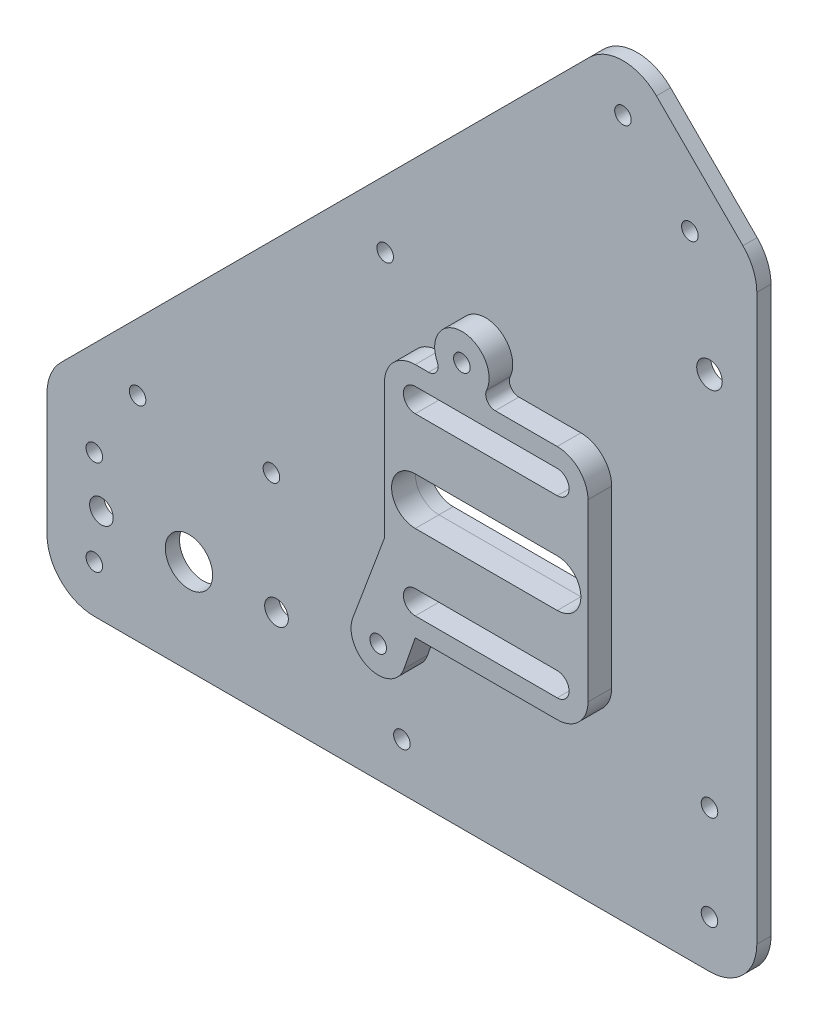
from build123d import *

# Parameters (mm, degrees)
FRAME_BRACKET_ALU_START       = 37.832624059
FRAME_BRACKET_ALU_OUTLINE_R   = 1.75
FRAME_BRACKET_ALU_OUTLINE_R_2 = 2.5
FRAME_BRACKET_ALU_OUTLINE_R_3 = 5
FRAME_BRACKET_ALU_OUTLINE_R_4 = 2.7
FRAME_BRACKET_ALU_DEPTH       = 3
SKETCH1_R                     = 1.75
BOSS_EXTRUDE1_DEPTH           = 5
FILLET1_R                     = 2


# Read off the part's stored shape, not the designer's step: frame_bracket_alu
with BuildPart() as part:
    # frame_bracket_alu outline → frame_bracket_alu (new body)
    with BuildSketch(Plane.XY.offset(FRAME_BRACKET_ALU_START)):
        with BuildLine():
            ThreePointArc((7.415225557, -30.959795658), (14.486293369, -28.03086347), (17.415225557, -20.959795658))
            Line((17.415225557, -20.959795658), (17.415225557, 98.329526223))
            ThreePointArc((17.415225557, 98.329526223), (16.654020882, 102.156360547), (14.486293369, 105.400594035))
            Line((14.486293369, 105.400594035), (-3.797977879, 123.684865282))
            ThreePointArc((-3.797977879, 123.684865282), (-10.86904569, 126.61379747), (-17.940113502, 123.684865282))
            Line((-17.940113502, 123.684865282), (-129.655842255, 11.96913653))
            ThreePointArc((-129.655842255, 11.96913653), (-131.823569768, 8.724903042), (-132.584774443, 4.898068718))
            Line((-132.584774443, 4.898068718), (-132.584774443, -20.959795658))
            ThreePointArc((-132.584774443, -20.959795658), (-129.655842255, -28.03086347), (-122.584774443, -30.959795658))
            Line((-122.584774443, -30.959795658), (7.415225557, -30.959795658))
        make_face()
        with Locations((-122.584774443, -20.959795658)):
            Circle(FRAME_BRACKET_ALU_OUTLINE_R, mode=Mode.SUBTRACT)
        with Locations((-121.084774443, -10.959795658)):
            Circle(FRAME_BRACKET_ALU_OUTLINE_R_2, mode=Mode.SUBTRACT)
        with Locations((-122.584774443, -0.959795658)):
            Circle(FRAME_BRACKET_ALU_OUTLINE_R, mode=Mode.SUBTRACT)
        with Locations((-102.584774443, -10.959795658)):
            Circle(FRAME_BRACKET_ALU_OUTLINE_R_3, mode=Mode.SUBTRACT)
        with Locations((-84.084774443, -10.959795658)):
            Circle(FRAME_BRACKET_ALU_OUTLINE_R_2, mode=Mode.SUBTRACT)
        with Locations((-113.442638819, 14.040204342)):
            Circle(FRAME_BRACKET_ALU_OUTLINE_R, mode=Mode.SUBTRACT)
        with Locations((-85.158367572, 14.040204342)):
            Circle(FRAME_BRACKET_ALU_OUTLINE_R, mode=Mode.SUBTRACT)
        with Locations((-57.584774443, -20.959795658)):
            Circle(FRAME_BRACKET_ALU_OUTLINE_R, mode=Mode.SUBTRACT)
        with Locations((-57.584774443, -0.959795658)):
            Circle(FRAME_BRACKET_ALU_OUTLINE_R, mode=Mode.SUBTRACT)
        with Locations((7.415225557, -20.959795658)):
            Circle(FRAME_BRACKET_ALU_OUTLINE_R, mode=Mode.SUBTRACT)
        with Locations((7.415225557, -0.959795658)):
            Circle(FRAME_BRACKET_ALU_OUTLINE_R, mode=Mode.SUBTRACT)
        with BuildLine():
            Line((-49.764538098, 13.040204342), (-19.764538098, 13.040204342))
            ThreePointArc((-19.764538098, 13.040204342), (-17.264538098, 10.540204342), (-19.764538098, 8.040204342))
            Line((-19.764538098, 8.040204342), (-49.764538098, 8.040204342))
            ThreePointArc((-49.764538098, 8.040204342), (-52.264538098, 10.540204342), (-49.764538098, 13.040204342))
        make_face(mode=Mode.SUBTRACT)
        with BuildLine():
            Line((-49.764538098, 34.040204342), (-19.764538098, 34.040204342))
            ThreePointArc((-19.764538098, 34.040204342), (-14.764538098, 29.040204342), (-19.764538098, 24.040204342))
            Line((-19.764538098, 24.040204342), (-49.764538098, 24.040204342))
            ThreePointArc((-49.764538098, 24.040204342), (-54.764538098, 29.040204342), (-49.764538098, 34.040204342))
        make_face(mode=Mode.SUBTRACT)
        with BuildLine():
            Line((-49.764538098, 50.040204342), (-19.764538098, 50.040204342))
            ThreePointArc((-19.764538098, 50.040204342), (-17.264538098, 47.540204342), (-19.764538098, 45.040204342))
            Line((-19.764538098, 45.040204342), (-49.764538098, 45.040204342))
            ThreePointArc((-49.764538098, 45.040204342), (-52.264538098, 47.540204342), (-49.764538098, 50.040204342))
        make_face(mode=Mode.SUBTRACT)
        with Locations((-61.120308349, 66.362534812)):
            Circle(FRAME_BRACKET_ALU_OUTLINE_R, mode=Mode.SUBTRACT)
        with Locations((-39.907104913, 59.291467)):
            Circle(FRAME_BRACKET_ALU_OUTLINE_R, mode=Mode.SUBTRACT)
        with Locations((7.415225557, 78.329526223)):
            Circle(FRAME_BRACKET_ALU_OUTLINE_R_4, mode=Mode.SUBTRACT)
        with Locations((3.273089933, 102.471661847)):
            Circle(FRAME_BRACKET_ALU_OUTLINE_R, mode=Mode.SUBTRACT)
        with Locations((-10.86904569, 116.61379747)):
            Circle(FRAME_BRACKET_ALU_OUTLINE_R, mode=Mode.SUBTRACT)
    extrude(amount=FRAME_BRACKET_ALU_DEPTH)


with BuildPart() as body_2:
    # Sketch1 → Boss-Extrude1 (new body)
    with BuildSketch(Plane.XY.offset(40.832624059)):
        with BuildLine():
            Line((-49.764538098, 4.040204342), (-19.764538098, 4.040204342))
            ThreePointArc((-19.764538098, 4.040204342), (-15.16834402, 5.944010264), (-13.264538098, 10.540204342))
            Line((-13.264538098, 10.540204342), (-13.264538098, 29.040204342))
            Line((-13.264538098, 29.040204342), (-13.264538098, 47.540204342))
            ThreePointArc((-13.264538098, 47.540204342), (-15.16834402, 52.136398419), (-19.764538098, 54.040204342))
            Line((-19.764538098, 54.040204342), (-37.564725676, 54.040204342))
            ThreePointArc((-37.564725676, 54.040204342), (-39.907104913, 65.041467), (-42.249484151, 54.040204342))
            Line((-42.249484151, 54.040204342), (-49.764538098, 54.040204342))
            ThreePointArc((-49.764538098, 54.040204342), (-54.360732176, 52.136398419), (-56.264538098, 47.540204342))
            Line((-56.264538098, 47.540204342), (-56.264538098, 29.040204342))
            Line((-56.264538098, 29.040204342), (-56.264538098, 19.040204342))
            Line((-56.264538098, 19.040204342), (-62.972474824, 1.048981235))
            ThreePointArc((-62.972474824, 1.048981235), (-59.53139851, -6.370262805), (-52.152257503, -2.844008942))
            Line((-52.152257503, -2.844008942), (-49.764538098, 4.040204342))
        make_face()
        with Locations((-57.584774443, -0.959795658)):
            Circle(SKETCH1_R, mode=Mode.SUBTRACT)
        with Locations((-39.907104913, 59.291467)):
            Circle(SKETCH1_R, mode=Mode.SUBTRACT)
        with BuildLine():
            Line((-49.764538098, 8.040204342), (-19.764538098, 8.040204342))
            ThreePointArc((-19.764538098, 8.040204342), (-17.264538098, 10.540204342), (-19.764538098, 13.040204342))
            Line((-19.764538098, 13.040204342), (-49.764538098, 13.040204342))
            ThreePointArc((-49.764538098, 13.040204342), (-52.264538098, 10.540204342), (-49.764538098, 8.040204342))
        make_face(mode=Mode.SUBTRACT)
        with BuildLine():
            Line((-49.764538098, 24.040204342), (-19.764538098, 24.040204342))
            ThreePointArc((-19.764538098, 24.040204342), (-14.764538098, 29.040204342), (-19.764538098, 34.040204342))
            Line((-19.764538098, 34.040204342), (-49.764538098, 34.040204342))
            ThreePointArc((-49.764538098, 34.040204342), (-54.764538098, 29.040204342), (-49.764538098, 24.040204342))
        make_face(mode=Mode.SUBTRACT)
        with BuildLine():
            Line((-49.764538098, 45.040204342), (-19.764538098, 45.040204342))
            ThreePointArc((-19.764538098, 45.040204342), (-17.264538098, 47.540204342), (-19.764538098, 50.040204342))
            Line((-19.764538098, 50.040204342), (-49.764538098, 50.040204342))
            ThreePointArc((-49.764538098, 50.040204342), (-52.264538098, 47.540204342), (-49.764538098, 45.040204342))
        make_face(mode=Mode.SUBTRACT)
    extrude(amount=BOSS_EXTRUDE1_DEPTH)

    # Fillet1
    fillet1_edges = [body_2.edges().sort_by_distance(p)[0] for p in [
        (-42.249484151, 54.040204342, 43.332624059),
        (-37.564725676, 54.040204342, 43.332624059),
    ]]
    fillet(fillet1_edges, radius=FILLET1_R)


solid = Compound([part.part, body_2.part])
